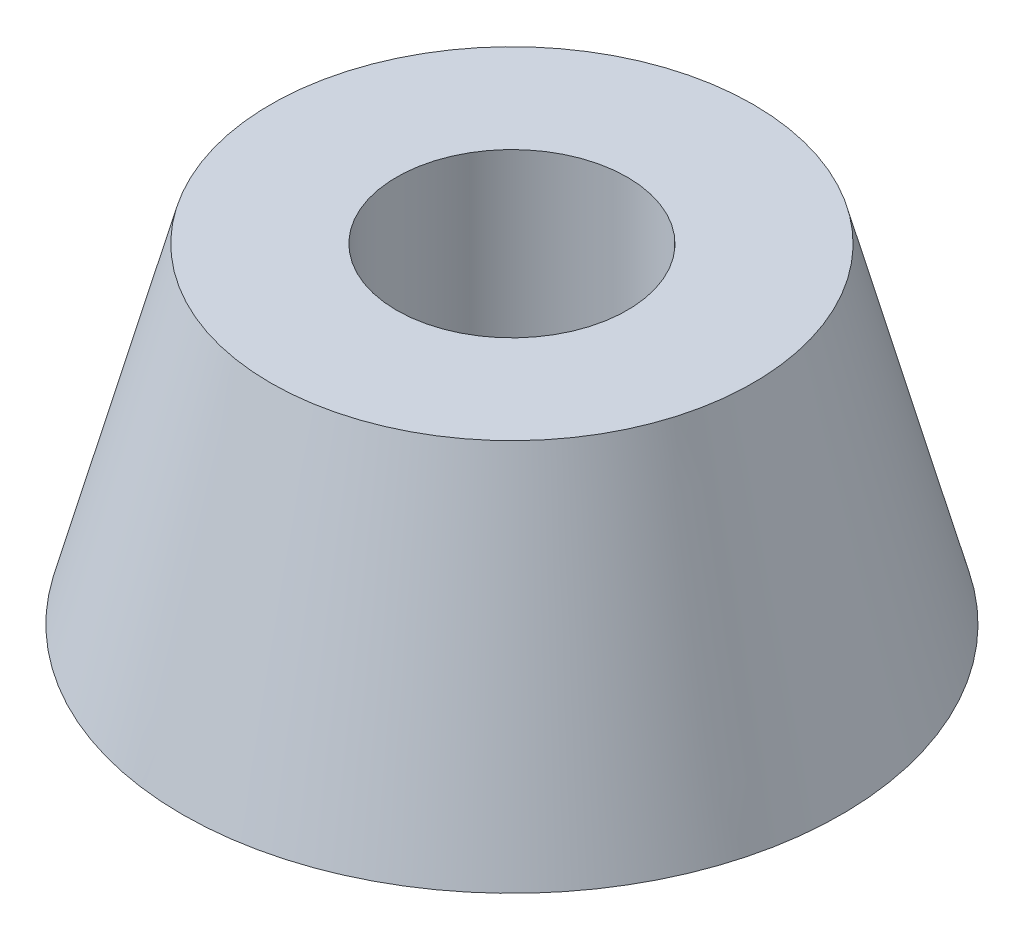
from build123d import *

# Parameters (mm, degrees)
ESQUISSE1_R             = 6
BOSS_EXTRU_1_DEPTH      = 6
BOSS_EXTRU_1_TAPER      = 15
ENL_V_MAT_EXTRU_1_REACH = 12.392
ESQUISSE2_R             = 2.1


with BuildPart() as part:
    # Esquisse1 → Boss.-Extru.1 (new body)
    with BuildSketch(Plane(origin=(0, 0, 0), x_dir=(1, 0, 0), z_dir=(0, 1, 0))):
        Circle(ESQUISSE1_R)
    extrude(amount=BOSS_EXTRU_1_DEPTH, taper=BOSS_EXTRU_1_TAPER)

    # Esquisse2 → Enlèv. mat.-Extru.1 (cut, up to next)
    with BuildSketch(Plane(origin=(0, 6, 0), x_dir=(1, 0, 0), z_dir=(0, 1, 0)), mode=Mode.PRIVATE) as enl_v_mat_extru_1_sk1:
        Circle(ESQUISSE2_R)
    enl_v_mat_extru_1_tool1 = extrude(enl_v_mat_extru_1_sk1.sketch, amount=-ENL_V_MAT_EXTRU_1_REACH, mode=Mode.PRIVATE) & part.part
    add(enl_v_mat_extru_1_tool1.solids().sort_by_distance((0, 6, 0))[0], mode=Mode.SUBTRACT)


solid = part.part
